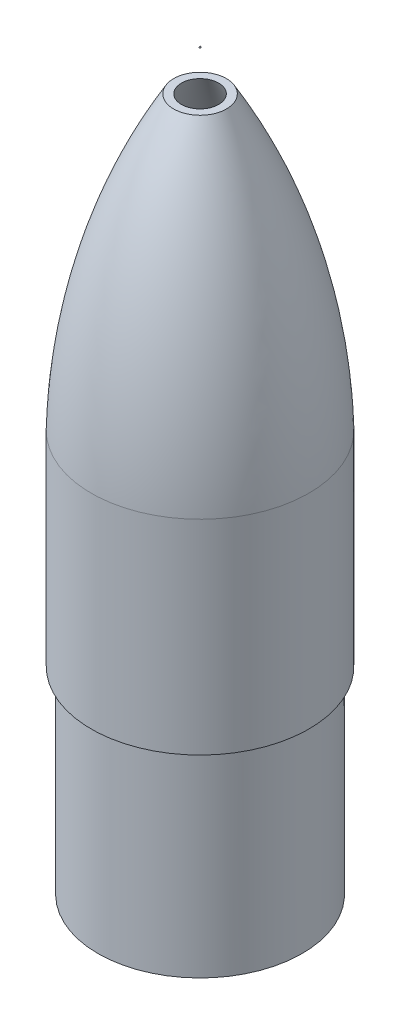
from build123d import *

# Parameters (mm, degrees)
BOSS_EXTRUDE1_START = -300
SKETCH2_R           = 76.2
SKETCH2_R_2         = 74.2
BOSS_EXTRUDE1_DEPTH = 300
SKETCH3_R           = 132.244783432
CUT_EXTRUDE1_DEPTH  = 30


with BuildPart() as part:
    # Sketch1 → Revolve3 (revolve)
    with BuildSketch(Plane.XY):
        with BuildLine():
            Line((81.2, -0.871238495), (81.2, 151.528761505))
            add(Edge.make_bspline(
                [(0, 400), (0.21512819, 399.690729707), (0.647250486, 399.067410681), (1.565845023, 397.737398682), (2.567932583, 396.271636658), (3.569477424, 394.794079547), (4.583341779, 393.286237082), (5.583513258, 391.78550571), (6.579194989, 390.278655925), (7.574319145, 388.759551188), (8.568689997, 387.22824247), (16.804798615, 374.432094359), (28.915617484, 353.69406513), (43.468930106, 324.277916737), (58.953588444, 283.709596797), (70.363256248, 243.72040023), (76.423129041, 210.995892043), (79.27772315, 185.760608329), (80.320266603, 171.031162239), (80.521504333, 167.817267665), (80.674774788, 165.072840404), (80.768770512, 163.259249979), (80.855079485, 161.455214612), (80.934151396, 159.653493097), (81.006375498, 157.837811408), (81.070645105, 156.054352063), (81.127543536, 154.278748614), (81.1716137, 152.663840286), (81.19097851, 151.905387082), (81.2, 151.528761505)],
                knots=[0.082616428, 0.082616428, 0.082616428, 0.082616428, 0.082616428, 0.088299706, 0.093982984, 0.099666263, 0.105349541, 0.111032819, 0.116716097, 0.122399375, 0.128082653, 0.133891142, 0.139699631, 0.313954311, 0.430124092, 0.546293874, 0.685697612, 0.836718331, 0.848335309, 0.865760775, 0.871569264, 0.877252541, 0.882935819, 0.888619096, 0.894302373, 0.899985651, 0.905668928, 0.911352205, 0.917035483, 0.917035483, 0.917035483, 0.917035483, 0.917035483], degree=4))
            Line((0, 400), (0, 391.140795975))
            add(Edge.make_bspline(
                [(0, 391.140795975), (0.17087675, 390.886464651), (1.104468707, 389.493929978), (2.778210635, 386.966525584), (7.241356886, 380.092401217), (16.565092798, 364.988167218), (34.852530416, 331.381875612), (55.616615418, 280.709649662), (68.791610905, 227.556738716), (73.884940397, 189.637359754), (75.282863635, 171.942411852), (75.741719179, 163.759208248), (75.901630193, 160.355534213), (75.997605755, 157.957419519), (76.047423596, 156.602074722), (76.082246172, 155.593689952), (76.115170602, 154.566456369), (76.148009519, 153.446282262), (76.173067448, 152.528243273), (76.189471697, 151.896709726), (76.196488087, 151.614100869), (76.2, 151.468648164)],
                knots=[0.105766306, 0.105766306, 0.105766306, 0.105766306, 0.108684888, 0.121719117, 0.134753347, 0.186890266, 0.291164104, 0.49971178, 0.708259456, 0.812533294, 0.864670213, 0.877704443, 0.890738673, 0.897255788, 0.900514345, 0.903772903, 0.90703146, 0.910290018, 0.913548575, 0.915177854, 0.916807132, 0.916807132, 0.916807132, 0.916807132], degree=3))
            Line((76.2, 151.468648164), (76.2, -0.871238495))
            Line((76.2, -0.871238495), (81.2, -0.871238495))
        make_face()
    revolve(axis=Axis((0, -198.817850362, 0), (0, -1, 0)))

    # Sketch2 → Boss-Extrude1 (add)
    with BuildSketch(Plane(origin=(0, 151.528761505, 0), x_dir=(1, 0, 0), z_dir=(0, 1, 0)).offset(BOSS_EXTRUDE1_START)):
        Circle(SKETCH2_R)
        Circle(SKETCH2_R_2, mode=Mode.SUBTRACT)
    extrude(amount=BOSS_EXTRUDE1_DEPTH)

    # Sketch3 → Cut-Extrude1 (cut)
    with BuildSketch(Plane(origin=(0, 399.128761505, 0), x_dir=(-1, 0, 0), z_dir=(0, -1, 0))):
        Circle(SKETCH3_R)
    extrude(amount=CUT_EXTRUDE1_DEPTH, mode=Mode.SUBTRACT)


with BuildPart() as cut_extrude1_piece_1:
    # of the separate pieces the step leaves, piece 1, a body of its own (cut_extrude1_pieces)
    add(part.part.solids().sort_by_distance((81.2, -0.871238495, 0))[0])


with BuildPart() as cut_extrude1_piece_2:
    # of the separate pieces the step leaves, piece 2, a body of its own (cut_extrude1_pieces)
    add(part.part.solids().sort_by_distance((0.604142294, 399.128761505, 0))[0])


solid = Compound([cut_extrude1_piece_1.part, cut_extrude1_piece_2.part])
